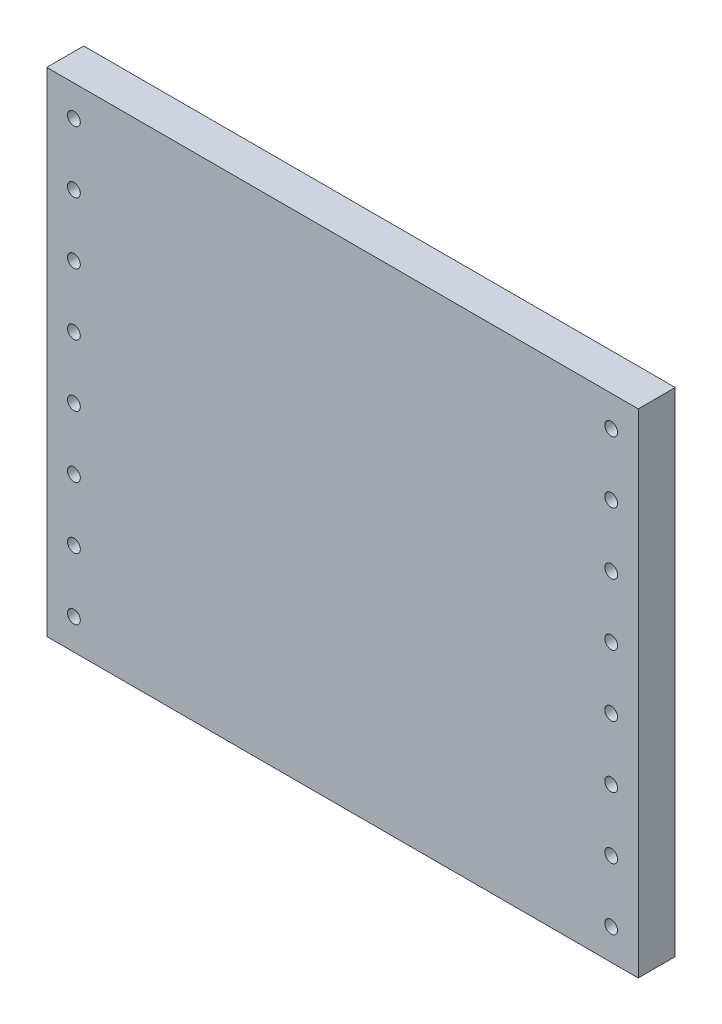
from build123d import *

# Parameters (mm, degrees)
SKETCH1_W           = 240
SKETCH1_H           = 200
BOSS_EXTRUDE1_DEPTH = 7.5
SKETCH4_R           = 2.6
CUT_EXTRUDE3_DEPTH  = 157.923548265
LPATTERN1_COUNT     = 8
LPATTERN1_PITCH     = 25


with BuildPart() as part:
    # Sketch1 → Boss-Extrude1 (new, symmetric)
    with BuildSketch(Plane.XY):
        Rectangle(SKETCH1_W, SKETCH1_H)
    extrude(amount=BOSS_EXTRUDE1_DEPTH, both=True)

    # Sketch4 → Cut-Extrude3 (cut, through all)
    with BuildSketch(Plane.XY.offset(7.5)):
        with Locations((-109, 87.5)):
            Circle(SKETCH4_R)
        with Locations((109, 87.5)):
            Circle(SKETCH4_R)
    cut_extrude3 = extrude(amount=-CUT_EXTRUDE3_DEPTH, mode=Mode.SUBTRACT)

    # LPattern1: Cut-Extrude3 ×8
    with Locations(*[(0, -i * LPATTERN1_PITCH, 0) for i in range(1, LPATTERN1_COUNT)]):
        add(cut_extrude3, mode=Mode.SUBTRACT)


solid = part.part
